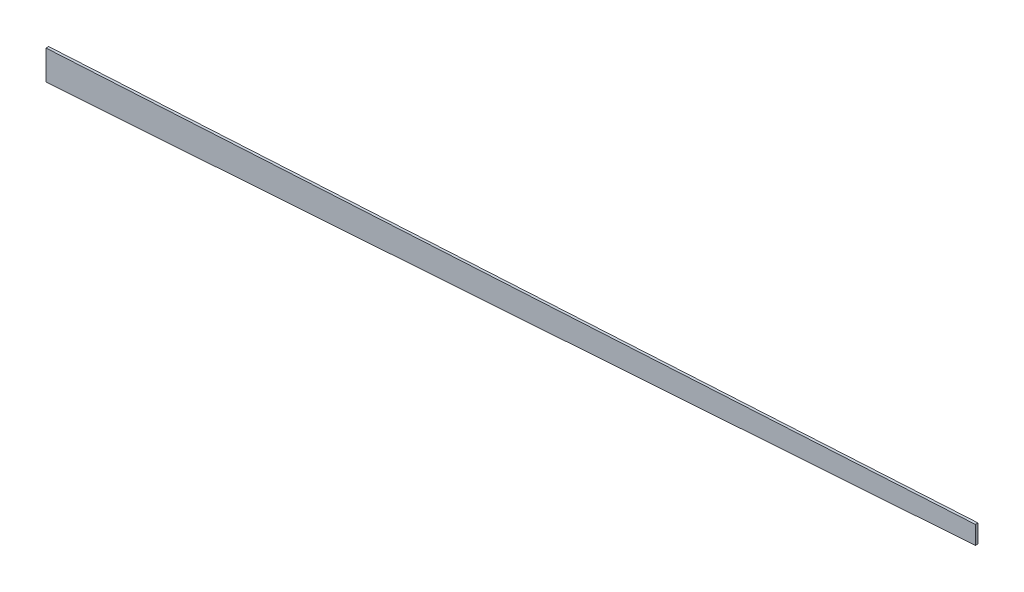
from build123d import *

# Parameters (mm, degrees)
SKETCH_1_W               = 4.193920874
SKETCH_1_H               = 122.960997171
SKETCH_1_W_2             = 3
SKETCH_1_H_2             = 125.815298494
SKETCH_1_H_3             = 240
SKETCH_1_H_4             = 235.575244244
CUT_EXTRUDE_2_DEPTH      = 30
CUT_EXTRUDE_4_DEPTH      = 1017.315034938
CUT_EXTRUDE_4_DEPTH_BACK = 1017.315034938
SKETCH_24_W              = 1156.773882232
SKETCH_24_H              = 274.681970243


with BuildPart() as part:
    # Эскиз20 → По сечениям1 section 0
    with BuildSketch(Plane(origin=(-1000, 0, 0), x_dir=(0, 0, -1), z_dir=(1, 0, 0))):
        with BuildLine():
            Line((170.5, 0), (170.5, 25.918739381))
            Line((170.5, 25.918739381), (173.5, 25.918739381))
            Line((173.5, 25.918739381), (173.5, -8.081260619))
            Line((173.5, -8.081260619), (170.5, -8.081260619))
            Line((170.5, -8.081260619), (170.5, 0))
        make_face()
    # Эскиз14 → По сечениям1 section 1
    with BuildSketch(Plane(origin=(0, 0, 0), x_dir=(0, 0, -1), z_dir=(1, 0, 0))):
        with BuildLine():
            Line((100.5, 0), (100.5, -5))
            Line((100.5, -5), (103.5, -5))
            Line((103.5, -5), (103.5, 16))
            Line((103.5, 16), (100.5, 16))
            Line((100.5, 16), (100.5, 0))
        make_face()
    loft()

    # Эскиз1 → Вырез-Вытянуть2 (cut)
    with BuildSketch(Plane(origin=(0, 0, 0), x_dir=(1, 0, 0), z_dir=(0, 1, 0))):
        with Locations((-999.096960437, 178.519501415)):
            Rectangle(SKETCH_1_W, SKETCH_1_H)
        with Locations((-1.5, 62.907649247)):
            Rectangle(SKETCH_1_W_2, SKETCH_1_H_2)
        with Locations((-795.5, 120)):
            Rectangle(SKETCH_1_W_2, SKETCH_1_H_3)
        with Locations((-592.5, 117.787622122)):
            Rectangle(SKETCH_1_W_2, SKETCH_1_H_4)
        with Locations((-389.5, 117.787622122)):
            Rectangle(SKETCH_1_W_2, SKETCH_1_H_4)
        with Locations((-186.5, 117.787622122)):
            Rectangle(SKETCH_1_W_2, SKETCH_1_H_4)
    extrude(amount=CUT_EXTRUDE_2_DEPTH, mode=Mode.SUBTRACT)

    # Эскиз24 → Вырез-Вытянуть4 (cut, two sides: drawn at the far end of the back side and taken through both)
    with BuildSketch(Plane(origin=(0, 0, 0), x_dir=(1, 0, 0), z_dir=(0, 1, 0)).offset(-CUT_EXTRUDE_4_DEPTH_BACK)):
        with Locations((-473.050070844, 146.669806752)):
            Rectangle(SKETCH_24_W, SKETCH_24_H)
    extrude(amount=CUT_EXTRUDE_4_DEPTH + CUT_EXTRUDE_4_DEPTH_BACK, mode=Mode.SUBTRACT)


with BuildPart() as body_2:
    # По сечениям2: read off the stored shape, not the designer's step
    # По сечениям2: loft between two sections, ruled curve by curve
    loft_2_from = [
        Edge.make_line((-1000, -8, 176.5), (-1000, 26, 176.5)),
        Edge.make_line((-1000, -8, 179.5), (-1000, -8, 176.5)),
        Edge.make_line((-1000, 26, 176.5), (-1000, 26, 179.5)),
        Edge.make_line((-1000, 26, 179.5), (-1000, -8, 179.5)),
    ]
    loft_2_to = [
        Edge.make_line((0, -5, 106.5), (0, 16, 106.5)),
        Edge.make_line((0, -5, 109.5), (0, -5, 106.5)),
        Edge.make_line((0, 16, 106.5), (0, 16, 109.5)),
        Edge.make_line((0, 16, 109.5), (0, -5, 109.5)),
    ]
    loft_2 = Solid(Shell([*[Face.make_surface_from_curves(loft_2_from[k], loft_2_to[k]) for k in range(4)], Face(Wire(loft_2_from)), Face(Wire(loft_2_to))]))
    add(loft_2)


solid = body_2.part
